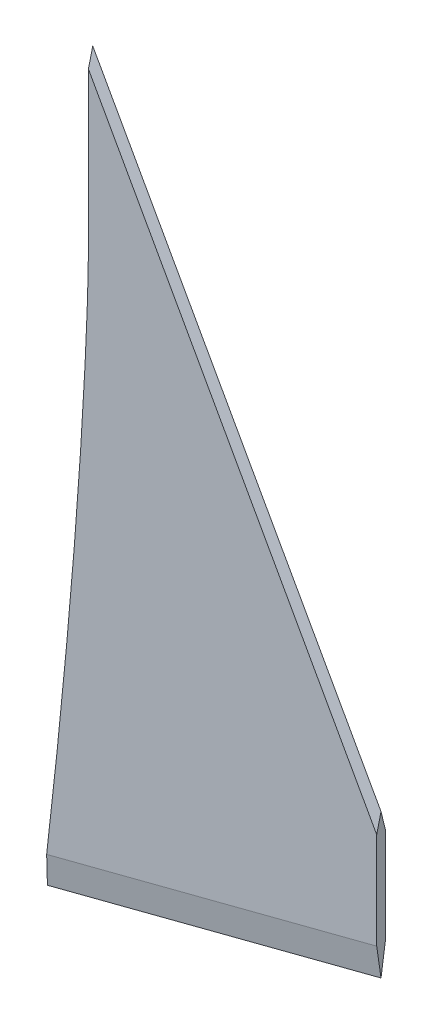
from build123d import *

# Parameters (mm, degrees)
BOSS_EXTRUDE1_DEPTH = 3
CHAMFER6_SIZE       = 1.5
CHAMFER6_SIZE_2     = 3
CHAMFER7_SIZE       = 1.5
CHAMFER7_SIZE_2     = 3
CHAMFER8_SIZE       = 10
CHAMFER8_SIZE_2     = 1.5
CHAMFER9_SIZE       = 10
CHAMFER9_SIZE_2     = 1.5


with BuildPart() as part:
    # Sketch1 → Boss-Extrude1 (new body)
    with BuildSketch(Plane.XY):
        Polygon((76, 560.990034), (176, 380.990034), (176, 330.990034), (60.272319057, 300.990034), (0, 300.990034), (0, 560.990034), align=None)
    extrude(amount=BOSS_EXTRUDE1_DEPTH)

    # Sketch2 → Cut-Revolve1 (revolve, cut)
    with BuildSketch(Plane.XY.offset(1.5)):
        with BuildLine():
            Line((76, 500), (76, 585.578863385))
            Line((76, 585.578863385), (0, 585.578863385))
            Line((0, 585.578863385), (0, 0))
            add(Edge.make_bspline(
                [(0, 0), (0.013783816, 0.003488157), (0.04033603, 0.01319051), (0.089619378, 0.042063455), (0.174781236, 0.103253354), (0.279068591, 0.195655925), (0.394476748, 0.312893359), (0.511330855, 0.444471001), (0.661995475, 0.626416713), (0.874340043, 0.905417524), (1.210288344, 1.39310301), (1.747935993, 2.271497179), (2.58108843, 3.81588258), (3.907734136, 6.629844229), (5.990626535, 11.732179856), (8.974782838, 20.21551767), (12.492116493, 31.724489027), (16.281172086, 45.606799288), (21.020860811, 64.651371321), (26.206631662, 87.658368898), (31.746320492, 114.722363422), (37.537896498, 145.854010301), (42.871807206, 177.066921726), (47.80723428, 208.345145014), (52.381191067, 239.678124678), (56.615153522, 271.058803785), (60.519680025, 302.482154914), (63.648418258, 330.011833268), (66.11894295, 353.631593101), (68.030132581, 373.329466343), (69.466784443, 389.09643856), (70.806129018, 404.87199461), (71.886996993, 418.683052253), (72.742662769, 430.526418849), (73.404435972, 440.399441684), (73.901071328, 448.299980017), (74.304775576, 455.214817724), (74.62677953, 461.143160456), (74.877801518, 466.084350078), (75.067577987, 470.037846817), (75.336303636, 476.005510657), (75.563352259, 481.736537174), (75.748085722, 487.230769759), (75.884662604, 492.488061525), (75.940348523, 495.116996281), (75.978043797, 497.370577281), (75.993594118, 498.87307617), (76, 499.624354134), (76, 500)],
                knots=[0, 0, 0, 0, 0, 0.000111673, 0.000223346, 0.000446692, 0.000826683, 0.001206674, 0.00151955, 0.001832426, 0.00268779, 0.00396812, 0.006183448, 0.009942812, 0.016507085, 0.02846832, 0.049586633, 0.080772227, 0.111303184, 0.141834141, 0.204203935, 0.266574069, 0.32894426, 0.39131442, 0.453684463, 0.516054568, 0.578424701, 0.640794795, 0.703164955, 0.734350023, 0.765535092, 0.796720055, 0.827905019, 0.859090157, 0.874682727, 0.890275296, 0.905867787, 0.921460278, 0.929256523, 0.937052769, 0.944849014, 0.95264526, 0.97632263, 0.982241972, 0.988161315, 0.994080657, 0.997040329, 1, 1, 1, 1, 1], degree=4))
        make_face()
    revolve(axis=Axis((0, 0, 1.5), (0, 1, 0)), mode=Mode.SUBTRACT)

    # Chamfer6
    # the kernel refuses this chamfer: 3, 1.5 mm, written as the material it takes off along each edge
    with BuildSketch(Plane(origin=(72.226803743, 567.781787262, 3), x_dir=(0.060245471517658, 0.03346970639869887, -0.9976223042390342), z_dir=(0.4856429311786319, -0.8741572761215379, 0))) as chamfer6_piece_1:
        Polygon((CHAMFER6_SIZE * 0.997622304239, -CHAMFER6_SIZE * 0.0689183436017), (-CHAMFER6_SIZE_2 * 0.0689183436017, -CHAMFER6_SIZE_2 * 0.997622304239), (0, 0), align=None)
    extrude(amount=221.451576062, mode=Mode.SUBTRACT)

    # Chamfer7
    # the kernel refuses this chamfer: 3, 1.5 mm, written as the material it takes off along each edge
    with BuildSketch(Plane(origin=(72.226803743, 567.781787262, 0), x_dir=(0.060245471517658, 0.03346970639869887, 0.9976223042390342), z_dir=(0.4856429311786319, -0.8741572761215379, 0))) as chamfer7_piece_1:
        Polygon((CHAMFER7_SIZE * 0.997622304239, CHAMFER7_SIZE * 0.0689183436017), (-CHAMFER7_SIZE_2 * 0.0689183436017, CHAMFER7_SIZE_2 * 0.997622304239), (0, 0), align=None)
    extrude(amount=221.451576062, mode=Mode.SUBTRACT)

    # Chamfer8
    # the kernel refuses this chamfer: 10, 1.5 mm, written as the material it takes off along each edge
    with BuildSketch(Plane(origin=(201.157802967, 337.511672409, 3), x_dir=(-0.250930852134312, 0.9679881864854557, 0.005707737883485932), z_dir=(-0.9680039545618228, -0.2509349396809314, 0))) as chamfer8_piece_1:
        Polygon((CHAMFER8_SIZE * 0.999983710731, CHAMFER8_SIZE * 0.00570773788349), (-CHAMFER8_SIZE_2 * 0.00570773788349, CHAMFER8_SIZE_2 * 0.999983710731), (0, 0), align=None)
    extrude(amount=171.531620397, mode=Mode.SUBTRACT)

    # Chamfer9
    # the kernel refuses this chamfer: 10, 1.5 mm, written as the material it takes off along each edge
    with BuildSketch(Plane(origin=(201.157802967, 337.511672409, 0), x_dir=(-0.250930852134312, 0.9679881864854557, -0.005707737883485934), z_dir=(-0.9680039545618228, -0.2509349396809314, 0))) as chamfer9_piece_1:
        Polygon((CHAMFER9_SIZE * 0.999983710731, -CHAMFER9_SIZE * 0.00570773788349), (-CHAMFER9_SIZE_2 * 0.00570773788349, -CHAMFER9_SIZE_2 * 0.999983710731), (0, 0), align=None)
    extrude(amount=171.531620397, mode=Mode.SUBTRACT)


solid = part.part
